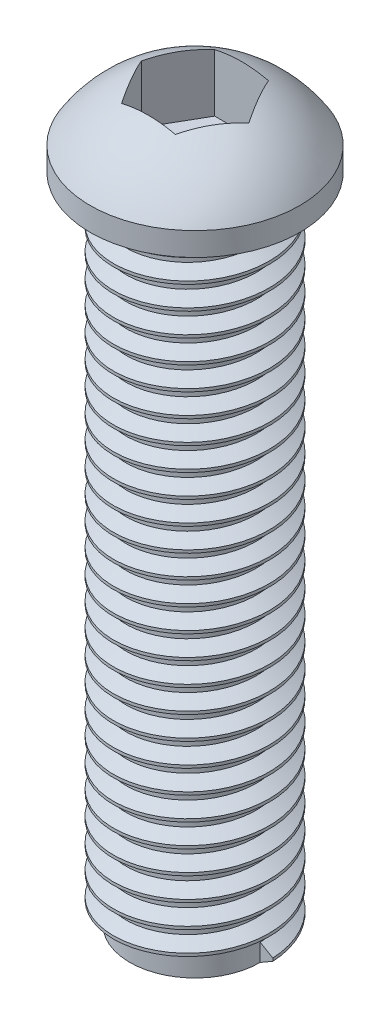
from build123d import *

# Parameters (mm, degrees)
SKETCH1_R           = 1.4
BOSS_EXTRUDE1_DEPTH = 14
CUT_EXTRUDE1_START  = 1.75
CUT_EXTRUDE1_DEPTH  = 1.5
THREAD2_PITCH       = 0.5


with BuildPart() as part:
    # Sketch1 → Boss-Extrude1 (new body)
    with BuildSketch(Plane(origin=(0, 0, 0), x_dir=(1, 0, 0), z_dir=(0, 1, 0))):
        with Locations(Location((0, 0, 0), (0, 0, 270))):
            Circle(SKETCH1_R)
    extrude(amount=-BOSS_EXTRUDE1_DEPTH)

    # Sketch2 → Revolve1 (revolve)
    with BuildSketch(Plane.XY):
        with BuildLine():
            Line((0, 0), (2.25, 0))
            Line((2.25, 0), (2.25, 0.5))
            ThreePointArc((2.25, 0.5), (1.286953768, 1.416516782), (0, 1.75))
            Line((0, 1.75), (0, 0))
        make_face()
    revolve(axis=Axis((0, 0, 0), (0, 1, 0)))

    # Sketch3 → Cut-Extrude1 (cut)
    with BuildSketch(Plane(origin=(0, 0, 0), x_dir=(1, 0, 0), z_dir=(0, 1, 0)).offset(CUT_EXTRUDE1_START)):
        Polygon((1.154700538, 0), (0.577350269, 1), (-0.577350269, 1), (-1.154700538, 0), (-0.577350269, -1), (0.577350269, -1), align=None)
    extrude(amount=-CUT_EXTRUDE1_DEPTH, mode=Mode.SUBTRACT)

    # Thread2: the profile of Thread Profile2 profile screwed along a right-hand helix of 28 turns, 6 arcs to a turn; built about Z, then put on its axis
    thread2_z = Axis((0, 0, 0), (0, 0, 1))
    thread2_corners = [(1.3997, 0, -0.000173205), (1.670632937, 0, 0.156249999), (1.670632937, 0, 0.218749999), (1.3997, 0, 0.375173204)]
    with BuildLine(mode=Mode.PRIVATE) as thread2_profile:
        Line(thread2_corners[0], thread2_corners[1])
        Line(thread2_corners[1], thread2_corners[2])
        Line(thread2_corners[2], thread2_corners[3])
        Line(thread2_corners[3], thread2_corners[0])
    thread2_cap = Face(thread2_profile.wire())
    thread2_turn_angles = [0, 30, 60, 90, 120, 150, 180, 210, 240, 270, 300, 330, 360]
    thread2_turn_weights = [1, 0.8660254037844387, 1, 0.8660254037844387, 1, 0.8660254037844387, 1, 0.8660254037844387, 1, 0.8660254037844387, 1, 0.8660254037844387, 1]
    thread2_turn_rails = [Edge.make_bspline([Vector(p[0], p[1], 0).rotate(thread2_z, thread2_turn_angles[k]) / thread2_turn_weights[k] + Vector(0, 0, p[2] + THREAD2_PITCH * thread2_turn_angles[k] / 360) for k in range(13)], [0, 0, 0, 1, 1, 2, 2, 3, 3, 4, 4, 5, 5, 6, 6, 6], 2, thread2_turn_weights) for p in thread2_corners]
    thread2_turn_sides = [Face.make_surface_from_curves(thread2_turn_rails[p[0]], thread2_turn_rails[p[1]]) for p in [(0, 1), (1, 2), (2, 3), (3, 0)]]
    thread2 = Plane(origin=(0, -14, 0), x_dir=(1, 0, 0), z_dir=(0, 1, 0)) * Solid(Shell([*[p.moved(Location((0, 0, THREAD2_PITCH * i))) for i in range(28) for p in thread2_turn_sides], thread2_cap, thread2_cap.rotate(thread2_z, 10080).moved(Location((0, 0, THREAD2_PITCH * 10080 / 360)))]))
    add(thread2)


solid = part.part
